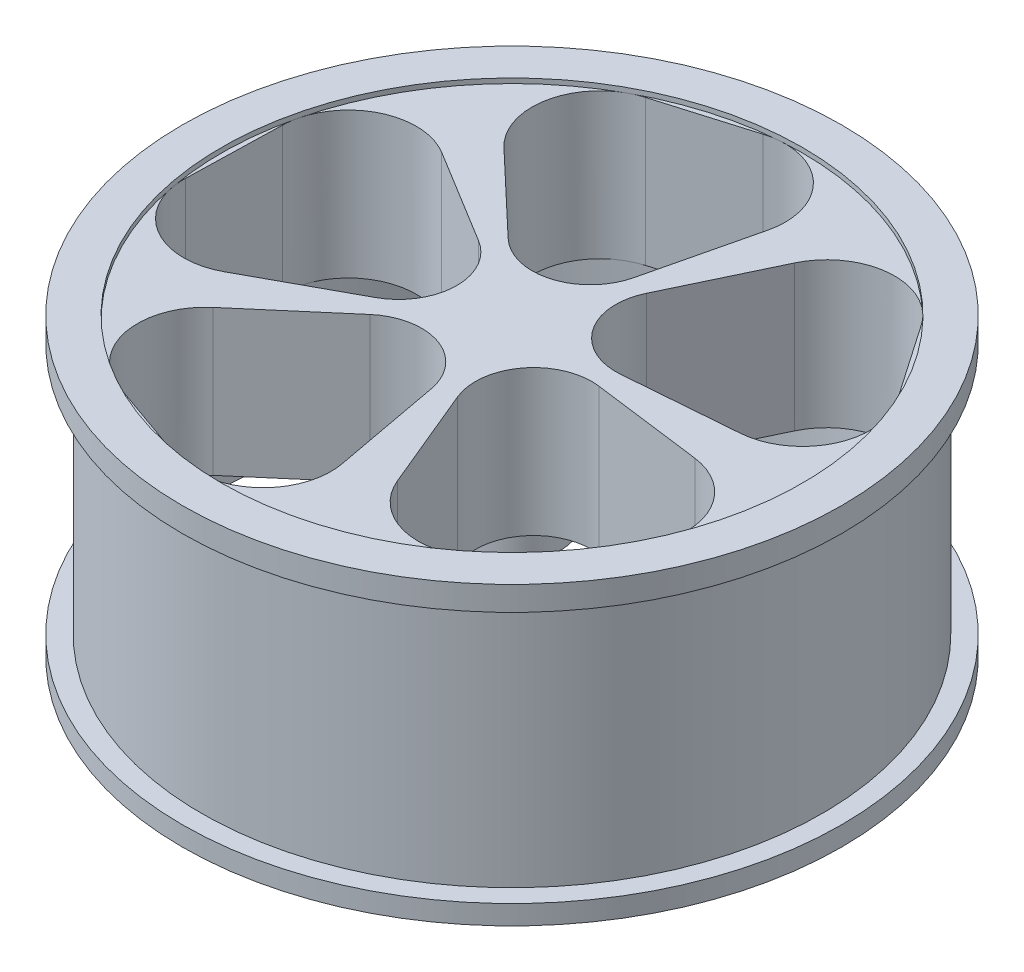
from build123d import *

# Parameters (mm, degrees)
SKETCH2_R               = 50
BOSS_EXTRUDE1_DEPTH     = 30
BOSS_EXTRUDE2_OUTLINE_R = 300
BOSS_EXTRUDE2_DEPTH     = 150
SKETCH5_R               = 340
SKETCH5_R_2             = 299.683220022
BOSS_EXTRUDE3_DEPTH     = 5


# Read off the part's stored shape, not the designer's step: Boss-Extrude2
with BuildPart() as part:
    # Sketch2 → Boss-Extrude1 (new body)
    with BuildSketch(Plane(origin=(0, 0, 0), x_dir=(1, 0, 0), z_dir=(0, 1, 0))):
        with Locations(Location((0, 0, 0), (0, 0, 270))):
            Circle(SKETCH2_R)
    extrude(amount=BOSS_EXTRUDE1_DEPTH)



with BuildPart() as body_2:
    # Sketch3 → Revolve1 (revolve)
    with BuildSketch(Plane.XY, mode=Mode.PRIVATE) as revolve1_sk:
        Polygon((-300, 30), (-300, 180), (-340, 180), (-340, 160), (-320, 160), (-320, -100), (-340, -100), (-340, -120), (-300, -120), align=None)
    revolve(revolve1_sk.sketch.rotate(Axis((0, 0, 0), (0, 1, 0)), 270), axis=Axis((0, 0, 0), (0, 1, 0)))


with BuildPart() as part_1:
    add(part.part)

    add(body_2.part)  # Boss-Extrude2 merges body 2
    # Boss-Extrude2 outline → Boss-Extrude2 (add)
    with BuildSketch(Plane(origin=(0, 30, 0), x_dir=(1, 0, 0), z_dir=(0, 1, 0))):
        Circle(BOSS_EXTRUDE2_OUTLINE_R)
        with BuildLine():
            Line((19.015351597, -102.16856857), (40.027027196, -215.063289879))
            ThreePointArc((40.027027196, -215.063289879), (16.710202797, -281.065757257), (-52.108022864, -293.874028681))
            Line((-52.108022864, -293.874028681), (-144.052181995, -261.392730661))
            ThreePointArc((-144.052181995, -261.392730661), (-189.553583257, -208.198534707), (-166.236758859, -142.196067329))
            Line((-166.236758859, -142.196067329), (-78.972900051, -67.55206183))
            ThreePointArc((-78.972900051, -67.55206183), (-19.985849485, -56.573543467), (19.015351597, -102.16856857))
        make_face(mode=Mode.SUBTRACT)
        with BuildLine():
            Line((103.044149697, -13.487149933), (216.906374893, -28.390246396))
            ThreePointArc((216.906374893, -28.390246396), (272.47315659, -70.96174827), (263.388545339, -140.369743763))
            Line((263.388545339, -140.369743763), (204.084687494, -217.776562353))
            ThreePointArc((204.084687494, -217.776562353), (139.433294545, -244.613055972), (83.866512848, -202.041554098))
            Line((83.866512848, -202.041554098), (39.841860382, -95.982426315))
            ThreePointArc((39.841860382, -95.982426315), (47.628670026, -36.489858749), (103.044149697, -13.487149933))
        make_face(mode=Mode.SUBTRACT)
        with BuildLine():
            Line((-91.292016101, -49.656498025), (-192.168311617, -104.526176482))
            ThreePointArc((-192.168311617, -104.526176482), (-262.145683303, -102.746442788), (-295.593074555, -41.254394372))
            Line((-295.593074555, -41.254394372), (-293.11383212, 56.226970393))
            ThreePointArc((-293.11383212, 56.226970393), (-256.583851687, 115.939285115), (-186.606480002, 114.159551422))
            Line((-186.606480002, 114.159551422), (-88.649796804, 54.232956094))
            ThreePointArc((-88.649796804, 54.232956094), (-59.980604302, 1.525486023), (-91.292016101, -49.656498025))
        make_face(mode=Mode.SUBTRACT)
        with BuildLine():
            Line((-75.43692045, 71.479165028), (-158.793575336, 150.462560099))
            ThreePointArc((-158.793575336, 150.462560099), (-178.725145082, 217.56496339), (-130.57854405, 268.377410774))
            Line((-130.57854405, 268.377410774), (-37.102128828, 296.142909448))
            ThreePointArc((-37.102128828, 296.142909448), (30.97604195, 279.85295354), (50.907611696, 212.750550249))
            Line((50.907611696, 212.750550249), (24.184312531, 101.069872007))
            ThreePointArc((24.184312531, 101.069872007), (-17.08420264, 57.516345678), (-75.43692045, 71.479165028))
        make_face(mode=Mode.SUBTRACT)
        with BuildLine():
            Line((44.669435257, 93.8330515), (94.028484864, 197.517152657))
            ThreePointArc((94.028484864, 197.517152657), (151.687468997, 237.208984925), (214.89109613, 207.120756043))
            Line((214.89109613, 207.120756043), (270.18345545, 126.799413173))
            ThreePointArc((270.18345545, 126.799413173), (275.72809845, 57.019352024), (218.069114317, 17.327519757))
            Line((218.069114317, 17.327519757), (103.596523942, 8.231660045))
            ThreePointArc((103.596523942, 8.231660045), (49.4219864, 34.021570515), (44.669435257, 93.8330515))
        make_face(mode=Mode.SUBTRACT)
    extrude(amount=BOSS_EXTRUDE2_DEPTH)

    # Sketch5 → Boss-Extrude3 (add)
    with BuildSketch(Plane(origin=(0, 180, 0), x_dir=(1, 0, 0), z_dir=(0, 1, 0))):
        with Locations(Location((0, 0, 0), (0, 0, 90))):
            Circle(SKETCH5_R)
        with Locations(Location((0, 0, 0), (0, 0, 94.287292905))):
            Circle(SKETCH5_R_2, mode=Mode.SUBTRACT)
    extrude(amount=BOSS_EXTRUDE3_DEPTH)


solid = part_1.part
